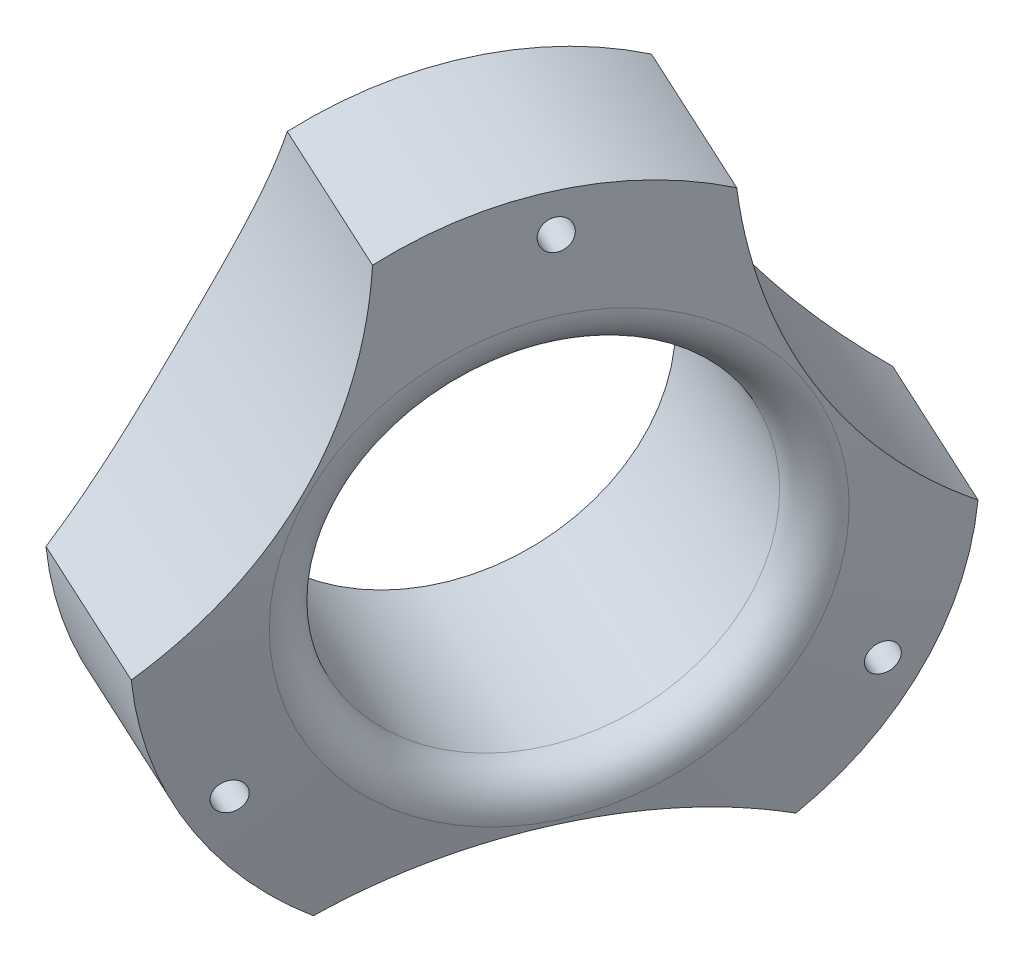
from build123d import *

# Parameters (mm, degrees)
SKETCH_2_R          = 1
SKETCH_2_R_2        = 29.5
SKETCH_2_R_3        = 12.5
CUT_EXTRUDE_1_DEPTH = 24
FILLET_1_R          = 2.5


with BuildPart() as part:
    # 草图1 → 旋转1 (revolve)
    with BuildSketch(Plane(origin=(0, 0, 0), x_dir=(1, 0, 0), z_dir=(0, 1, 0))):
        Polygon((0, 37.770722092), (0, 24.214301298), (11.03898857, 19.120089069), (17.219185363, 29.824503915), align=None)
    revolve(axis=Axis((22.240071284, 0, -38.520933429), (-0.9079814157812074, 0, -0.4190104397219171)))

    # 草图2 → 切除-拉伸1 (cut)
    with BuildSketch(Plane(origin=(2.849174683, 0, 1.314821995), x_dir=(0.41901043972191737, 0, -0.9079814157812073), z_dir=(0.9079814157812073, 0, 0.41901043972191737))):
        with Locations((44.29511372, 19.808976723)):
            Circle(SKETCH_2_R)
        with Locations((5.32397055, 22.5)):
            Circle(SKETCH_2_R_2)
        with Locations((83.266256891, 22.5)):
            Circle(SKETCH_2_R_2)
        with Locations((61.450190786, -9.904488362)):
            Circle(SKETCH_2_R)
        with Locations((44.29511372, -45)):
            Circle(SKETCH_2_R_2)
        with Locations((27.140036655, -9.904488362)):
            Circle(SKETCH_2_R)
        with Locations((44.29511372, 0)):
            Circle(SKETCH_2_R_3)
    extrude(amount=-CUT_EXTRUDE_1_DEPTH, mode=Mode.SUBTRACT)

    # 圆角1
    fillet_1_edges = [part.edges().sort_by_distance(p)[0] for p in [
        (21.201594379, 12.5, -39.000164234),
    ]]
    fillet(fillet_1_edges, radius=FILLET_1_R)


solid = part.part
